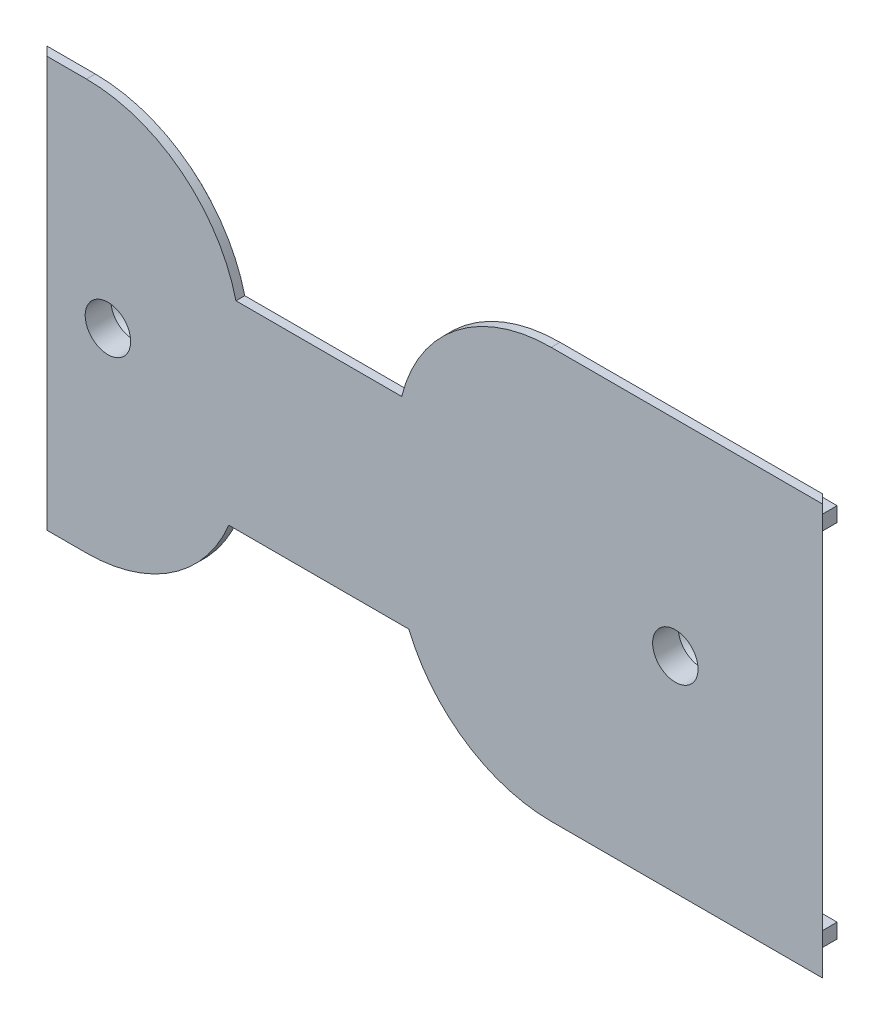
from build123d import *

# Parameters (mm, degrees)
SKETCH_2_R            = 2.6
EXTRUDE_1_DEPTH       = 1.2
EXTRUDE_1_2_DEPTH     = 2
CUT_EXTRUDE_START     = -2
CUT_EXTRUDE_1_DEPTH   = 2
SKETCH_5_W            = 2
SKETCH_5_H            = 47.2
CUT_EXTRUDE_1_2_DEPTH = 2
SKETCH_6_W            = 14.43
SKETCH_6_H            = 14
SKETCH_6_R            = 2.6
EXTRUDE_2_DEPTH       = 5.4
SKETCH_7_R            = 3
SKETCH_7_R_2          = 2
EXTRUDE_2_2_DEPTH     = 2
SKETCH_8_R            = 3.1
CUT_EXTRUDE_2_DEPTH   = 4.6
CHAMFER_1_SIZE        = 1.1
SKETCH_9_R            = 4.6
SKETCH_9_R_2          = 2
EXTRUDE_3_DEPTH       = 2
SKETCH_10_R           = 2.6
SKETCH_10_R_2         = 2
CUT_EXTRUDE_2_2_DEPTH = 2
CUT_EXTRUDE_3_DEPTH   = 62
SKETCH_12_W           = 1.2
SKETCH_12_H           = 2
CUT_EXTRUDE_4_DEPTH   = 62
CUT_EXTRUDE_5_DEPTH   = 62
CUT_EXTRUDE_6_DEPTH   = 2
FILLET_1_R            = 1


# Some blends are built 0.0001 mm under size
with BuildPart() as part:
    # Эскиз2 → Extrude 1 (new body)
    with BuildSketch(Plane.XY):
        with BuildLine():
            Line((31.7, -28), (69.1, -28))
            Line((69.1, -28), (69.1, 28))
            Line((69.1, 28), (31.7, 28))
            ThreePointArc((31.7, 28), (18.738518603, 23.522711642), (11.303921946, 12))
            Line((11.303921946, 12), (10.3, 12))
            Line((10.3, 12), (-11.303921946, 12))
            ThreePointArc((-11.303921946, 12), (-18.738518603, 23.522711642), (-31.7, 28))
            Line((-31.7, 28), (-38.7, 28))
            Line((-38.7, 28), (-38.7, 0))
            Line((-38.7, 0), (-38.7, -28))
            Line((-38.7, -28), (-31.7, -28))
            ThreePointArc((-31.7, -28), (-20.016678554, -24.449928367), (-12.283512161, -15))
            Line((-12.283512161, -15), (10.3, -15))
            Line((10.3, -15), (12.283512161, -15))
            ThreePointArc((12.283512161, -15), (20.016678554, -24.449928367), (31.7, -28))
        make_face()
        with Locations((-28.77, 0)):
            Circle(SKETCH_2_R, mode=Mode.SUBTRACT)
        with Locations((48.63, 0)):
            Circle(SKETCH_2_R, mode=Mode.SUBTRACT)
    extrude(amount=-EXTRUDE_1_DEPTH)

    # Эскиз3 → Extrude 1 2 (add)
    with BuildSketch(Plane(origin=(0, 0, -1.2), x_dir=(-1, 0, 0), z_dir=(0, 0, -1))):
        with BuildLine():
            Line((-12.764102729, 7.6), (13.3, 7.6))
            Line((13.3, 7.6), (13.3, 10.862098312))
            ThreePointArc((13.3, 10.862098312), (20.39638196, 21.767719655), (32.7, 26))
            Line((32.7, 26), (38.7, 26))
            Line((38.7, 26), (38.7, -26))
            Line((38.7, -26), (32.7, -26))
            ThreePointArc((32.7, -26), (21.149339249, -22.32734627), (13.840836227, -12.658223621))
            Line((13.840836227, -12.658223621), (13.840836227, -10.59197668))
            Line((13.840836227, -10.59197668), (13.3, -10.59197668))
            Line((13.3, -10.59197668), (13.3, -10.6))
            Line((13.3, -10.6), (-13.236187424, -10.6))
            ThreePointArc((-13.236187424, -10.6), (-20.290326354, -21.684387141), (-32.7, -26))
            Line((-32.7, -26), (-69.1, -26))
            Line((-69.1, -26), (-69.1, 26))
            Line((-69.1, 26), (-32.7, 26))
            ThreePointArc((-32.7, 26), (-19.135340034, 20.696938457), (-12.764102729, 7.6))
        make_face()
        with BuildLine():
            Line((-15.118191219, 5.2), (15.7, 5.2))
            Line((15.7, 5.2), (15.7, 10.5563143))
            ThreePointArc((15.7, 10.5563143), (21.986250229, 19.963365133), (32.7, 23.6))
            Line((32.7, 23.6), (36.3, 23.6))
            Line((36.3, 23.6), (36.3, -23.6))
            Line((36.3, -23.6), (32.7, -23.6))
            ThreePointArc((32.7, -23.6), (22.698719105, -20.482209102), (16.240836227, -12.233452326))
            Line((16.240836227, -12.233452326), (16.240836227, -8.19197668))
            Line((16.240836227, -8.19197668), (10.9, -8.19197668))
            Line((10.9, -8.19197668), (10.9, -8.2))
            Line((10.9, -8.2), (-15.238041347, -8.2))
            ThreePointArc((-15.238041347, -8.2), (-21.058694231, -19.2), (-32.7, -23.6))
            Line((-32.7, -23.6), (-66.7, -23.6))
            Line((-66.7, -23.6), (-66.7, 23.6))
            Line((-66.7, 23.6), (-32.7, 23.6))
            ThreePointArc((-32.7, 23.6), (-19.975221024, 18.158947323), (-15.118191219, 5.2))
        make_face(mode=Mode.SUBTRACT)
    extrude(amount=EXTRUDE_1_2_DEPTH)

    # Эскиз4 → Cut-Extrude 1 (cut)
    with BuildSketch(Plane(origin=(0, 0, -3.2), x_dir=(-1, 0, 0), z_dir=(0, 0, -1)).offset(CUT_EXTRUDE_START)):
        with BuildLine():
            Line((-13.236187424, -10.6), (13.3, -10.6))
            Line((13.3, -10.6), (13.3, -10.59197668))
            Line((13.3, -10.59197668), (13.840836227, -10.59197668))
            Line((13.840836227, -10.59197668), (13.840836227, -12.658223621))
            ThreePointArc((13.840836227, -12.658223621), (21.149339249, -22.32734627), (32.7, -26))
            Line((32.7, -26), (38.7, -26))
            Line((38.7, -26), (38.7, 26))
            Line((38.7, 26), (32.7, 26))
            ThreePointArc((32.7, 26), (20.39638196, 21.767719655), (13.3, 10.862098312))
            Line((13.3, 10.862098312), (13.3, 7.6))
            Line((13.3, 7.6), (-12.764102729, 7.6))
            ThreePointArc((-12.764102729, 7.6), (-19.135340034, 20.696938457), (-32.7, 26))
            Line((-32.7, 26), (-69.1, 26))
            Line((-69.1, 26), (-69.1, -26))
            Line((-69.1, -26), (-32.7, -26))
            ThreePointArc((-32.7, -26), (-20.290326354, -21.684387141), (-13.236187424, -10.6))
        make_face()
        with BuildLine():
            Line((-13.555287936, -10.2), (12.9, -10.2))
            Line((12.9, -10.2), (12.9, -10.19197668))
            Line((12.9, -10.19197668), (14.240836227, -10.19197668))
            Line((14.240836227, -10.19197668), (14.240836227, -12.589330224))
            ThreePointArc((14.240836227, -12.589330224), (21.408208123, -22.020469288), (32.7, -25.6))
            Line((32.7, -25.6), (38.3, -25.6))
            Line((38.3, -25.6), (38.3, 25.6))
            Line((38.3, 25.6), (32.7, 25.6))
            ThreePointArc((32.7, 25.6), (20.661824927, 21.467460713), (13.7, 10.812483766))
            Line((13.7, 10.812483766), (13.7, 7.2))
            Line((13.7, 7.2), (-13.136769183, 7.2))
            ThreePointArc((-13.136769183, 7.2), (-19.271671735, 20.277254638), (-32.7, 25.6))
            Line((-32.7, 25.6), (-68.7, 25.6))
            Line((-68.7, 25.6), (-68.7, -25.6))
            Line((-68.7, -25.6), (-32.7, -25.6))
            ThreePointArc((-32.7, -25.6), (-20.415049858, -21.27219696), (-13.555287936, -10.2))
        make_face(mode=Mode.SUBTRACT)
    extrude(amount=CUT_EXTRUDE_1_DEPTH, mode=Mode.SUBTRACT)

    # Эскиз5 → Cut-Extrude 1 2 (cut)
    with BuildSketch(Plane(origin=(0, 0, -3.2), x_dir=(-1, 0, 0), z_dir=(0, 0, -1))):
        with Locations((-67.7, 0)):
            Rectangle(SKETCH_5_W, SKETCH_5_H)
        with Locations((37.3, 0)):
            Rectangle(SKETCH_5_W, SKETCH_5_H)
    extrude(amount=-CUT_EXTRUDE_1_2_DEPTH, mode=Mode.SUBTRACT)

    # Эскиз6 → Extrude 2 (add)
    # profile 1 of 2: a face of its own
    with BuildSketch(Plane(origin=(0, 0, -1.2), x_dir=(-1, 0, 0), z_dir=(0, 0, -1))):
        with Locations((-48.415, 0)):
            Rectangle(SKETCH_6_W, SKETCH_6_H)
        with Locations(Location((-48.63, 0, 0), (0, 0, 180))):
            Circle(SKETCH_6_R, mode=Mode.SUBTRACT)
    # profile 2 of 2: a face of its own
    with BuildSketch(Plane(origin=(0, 0, -1.2), x_dir=(-1, 0, 0), z_dir=(0, 0, -1))):
        with Locations((28.985, 0)):
            Rectangle(SKETCH_6_W, SKETCH_6_H)
        with Locations(Location((28.77, 0, 0), (0, 0, 180))):
            Circle(SKETCH_6_R, mode=Mode.SUBTRACT)
    extrude(amount=EXTRUDE_2_DEPTH)

    # Эскиз7 → Extrude 2 2 (add)
    # profile 1 of 2: a face of its own
    with BuildSketch(Plane(origin=(0, 0, -6.6), x_dir=(-1, 0, 0), z_dir=(0, 0, -1))):
        with Locations((-48.63, 0)):
            Circle(SKETCH_7_R)
        with Locations((-48.63, 0)):
            Circle(SKETCH_7_R_2, mode=Mode.SUBTRACT)
    # profile 2 of 2: a face of its own
    with BuildSketch(Plane(origin=(0, 0, -6.6), x_dir=(-1, 0, 0), z_dir=(0, 0, -1))):
        with Locations((28.77, 0)):
            Circle(SKETCH_7_R)
        with Locations((28.77, 0)):
            Circle(SKETCH_7_R_2, mode=Mode.SUBTRACT)
    extrude(amount=-EXTRUDE_2_2_DEPTH)

    # Эскиз8 → Cut-Extrude 2 (cut)
    with BuildSketch(Plane.XY):
        with Locations((-28.77, 0)):
            Circle(SKETCH_8_R)
        with Locations((48.63, 0)):
            Circle(SKETCH_8_R)
    extrude(amount=-CUT_EXTRUDE_2_DEPTH, mode=Mode.SUBTRACT)

    # Фаска1
    chamfer_1_edges = [part.edges().sort_by_distance(p)[0] for p in [
        (-31.87, 0, -4.6),
        (45.53, 0, -4.6),
    ]]
    chamfer(chamfer_1_edges, length=CHAMFER_1_SIZE - 0.0001)  # a hair under: the kernel refuses the full size

    # Эскиз9 → Вытянуть-Тонкостенный3 (add)
    # profile 1 of 3: a face of its own
    with BuildSketch(Plane(origin=(0, 0, -1.2), x_dir=(-1, 0, 0), z_dir=(0, 0, -1))):
        with Locations((39.2, -18)):
            Circle(SKETCH_9_R)
        with Locations((39.2, -18)):
            Circle(SKETCH_9_R_2, mode=Mode.SUBTRACT)
    # profile 2 of 3: a face of its own
    with BuildSketch(Plane(origin=(0, 0, -1.2), x_dir=(-1, 0, 0), z_dir=(0, 0, -1))):
        with Locations((31.2, -18)):
            Circle(SKETCH_9_R)
        with Locations((31.2, -18)):
            Circle(SKETCH_9_R_2, mode=Mode.SUBTRACT)
    # profile 3 of 3: a face of its own
    with BuildSketch(Plane(origin=(0, 0, -1.2), x_dir=(-1, 0, 0), z_dir=(0, 0, -1))):
        with Locations((31.2, -10)):
            Circle(SKETCH_9_R)
        with Locations((31.2, -10)):
            Circle(SKETCH_9_R_2, mode=Mode.SUBTRACT)
    extrude(amount=EXTRUDE_3_DEPTH)

    # Эскиз10 → Cut-Extrude 2 2 (cut)
    # profile 1 of 3: a face of its own
    with BuildSketch(Plane(origin=(0, 0, -3.2), x_dir=(-1, 0, 0), z_dir=(0, 0, -1)).offset(CUT_EXTRUDE_START)):
        with Locations((39.2, -18)):
            Circle(SKETCH_10_R)
        with Locations((39.2, -18)):
            Circle(SKETCH_10_R_2, mode=Mode.SUBTRACT)
    # profile 2 of 3: a face of its own
    with BuildSketch(Plane(origin=(0, 0, -3.2), x_dir=(-1, 0, 0), z_dir=(0, 0, -1)).offset(CUT_EXTRUDE_START)):
        with Locations((31.2, -18)):
            Circle(SKETCH_10_R)
        with Locations((31.2, -18)):
            Circle(SKETCH_10_R_2, mode=Mode.SUBTRACT)
    # profile 3 of 3: a face of its own
    with BuildSketch(Plane(origin=(0, 0, -3.2), x_dir=(-1, 0, 0), z_dir=(0, 0, -1)).offset(CUT_EXTRUDE_START)):
        with Locations((31.2, -10)):
            Circle(SKETCH_10_R)
        with Locations((31.2, -10)):
            Circle(SKETCH_10_R_2, mode=Mode.SUBTRACT)
    extrude(amount=CUT_EXTRUDE_2_2_DEPTH, mode=Mode.SUBTRACT)

    # Эскиз11 → Вырез-Вытянуть3 (cut)
    with BuildSketch(Plane(origin=(0, 28, 0), x_dir=(1, 0, 0), z_dir=(0, 1, 0))):
        Polygon((67.5, 1.2), (69.1, 1.2), (69.1, 0), (68.7, 0), align=None)
    extrude(amount=-CUT_EXTRUDE_3_DEPTH, mode=Mode.SUBTRACT)

    # Эскиз12 → Вырез-Вытянуть4 (cut)
    with BuildSketch(Plane(origin=(0, 25.6, 0), x_dir=(1, 0, 0), z_dir=(0, 1, 0))):
        with Locations((68.1, 2.2)):
            Rectangle(SKETCH_12_W, SKETCH_12_H)
    extrude(amount=-CUT_EXTRUDE_4_DEPTH, mode=Mode.SUBTRACT)

    # Эскиз13 → Вырез-Вытянуть5 (cut)
    with BuildSketch(Plane(origin=(0, 28, 0), x_dir=(1, 0, 0), z_dir=(0, 1, 0))):
        Polygon((-38.7, 1.2), (-38.3, 1.2), (-37.1, 0), (-38.7, 0), align=None)
    extrude(amount=-CUT_EXTRUDE_5_DEPTH, mode=Mode.SUBTRACT)

    # Эскиз14 → Вырез-Вытянуть6 (cut)
    with BuildSketch(Plane.XY.offset(-1.2)):
        with BuildLine():
            Line((-38.3, -15.560737816), (-38.3, -13.488902573))
            ThreePointArc((-38.3, -13.488902573), (-43.8, -18), (-38.3, -22.511097427))
            Line((-38.3, -22.511097427), (-38.3, -20.439262184))
            Line((-38.3, -20.439262184), (-38.3, -15.560737816))
        make_face()
    extrude(amount=-CUT_EXTRUDE_6_DEPTH, mode=Mode.SUBTRACT)

    # Скругление1
    # the kernel refuses this fillet: 1 mm, written as the material it adds along each edge
    with BuildSketch(Plane(origin=(-31.2, -10, -1.2), x_dir=(-0.3113315217302395, 0.9503013646086874, 0), z_dir=(0.9503013646086874, 0.3113315217302395, 0))) as fillet_1_piece_1_section:
        with BuildLine():
            CenterArc((4.6 + FILLET_1_R, -FILLET_1_R), FILLET_1_R, 90, 90)
            Line((4.6, -FILLET_1_R), (4.6, 0))
            Line((4.6, 0), (4.6 + FILLET_1_R, 0))
        make_face()
    fillet_1_piece_1 = revolve(axis=Axis((-31.2, -10, -1.2), (0, 0, 1)), revolution_arc=163.423462372, mode=Mode.PRIVATE)
    fillet_1_piece_1 = fillet_1_piece_1 - Plane(origin=(-31.2, -18, -1.484354145), x_dir=(-1, 0, 0), z_dir=(0, 0, 1)) * Cylinder(2.6, 23, mode=Mode.PRIVATE)
    add(fillet_1_piece_1)
    with BuildSketch(Plane(origin=(-31.2, -10, -1.2), x_dir=(-0.027275325587211355, -0.99962795909984, 0), z_dir=(-0.99962795909984, 0.027275325587211355, 0))) as fillet_1_piece_2_section:
        with BuildLine():
            CenterArc((4.6 + FILLET_1_R, -FILLET_1_R), FILLET_1_R, 90, 90)
            Line((4.6, -FILLET_1_R), (4.6, 0))
            Line((4.6, 0), (4.6 + FILLET_1_R, 0))
        make_face()
    fillet_1_piece_2 = revolve(axis=Axis((-31.2, -10, -1.2), (0, 0, 1)), revolution_arc=163.423462372, mode=Mode.PRIVATE)
    fillet_1_piece_2 = fillet_1_piece_2 - Plane(origin=(-31.2, -18, -1.484354149), x_dir=(-1, 0, 0), z_dir=(0, 0, 1)) * Cylinder(2.6, 23, mode=Mode.PRIVATE)
    add(fillet_1_piece_2)
    with BuildSketch(Plane(origin=(-39.2, -18, -1.2), x_dir=(0.999633679916253, 0.027064847627327897, 0), z_dir=(-0.027064847627327897, 0.999633679916253, 0))) as fillet_1_piece_3_section:
        with BuildLine():
            CenterArc((4.6 + FILLET_1_R, FILLET_1_R), FILLET_1_R, 180, 90)
            Line((4.6, FILLET_1_R), (4.6, 0))
            Line((4.6, 0), (4.6 + FILLET_1_R, 0))
        make_face()
    fillet_1_piece_3 = revolve(axis=Axis((-39.2, -18, -1.2), (0, 0, -1)), revolution_arc=111.410803348, mode=Mode.PRIVATE)
    fillet_1_piece_3 = split(fillet_1_piece_3, bisect_by=Plane(origin=(-38.3, -21.845706148, -1.420542647), z_dir=(1, 0, 0)), keep=Keep.TOP, mode=Mode.PRIVATE)
    fillet_1_piece_3 = fillet_1_piece_3 - Plane(origin=(-31.2, -18, -1.420542647), x_dir=(-1, 0, 0), z_dir=(0, 0, 1)) * Cylinder(2.6, 23, mode=Mode.PRIVATE)
    add(fillet_1_piece_3)
    with BuildSketch(Plane(origin=(-31.2, -18, -1.2), x_dir=(-0.028198782541568913, 0.9996023352629652, 0), z_dir=(-0.9996023352629652, -0.028198782541568913, 0))) as fillet_1_piece_4_section:
        with BuildLine():
            CenterArc((4.6 + FILLET_1_R, FILLET_1_R), FILLET_1_R, 180, 90)
            Line((4.6, FILLET_1_R), (4.6, 0))
            Line((4.6, 0), (4.6 + FILLET_1_R, 0))
        make_face()
    fillet_1_piece_4 = revolve(axis=Axis((-31.2, -18, -1.2), (0, 0, -1)), revolution_arc=273.231770853, mode=Mode.PRIVATE)
    fillet_1_piece_4 = fillet_1_piece_4 - Plane(origin=(-39.2, -18, -1.481900137), x_dir=(-1, 0, 0), z_dir=(0, 0, 1)) * Cylinder(2.6, 23, mode=Mode.PRIVATE)
    fillet_1_piece_4 = fillet_1_piece_4 - Plane(origin=(-31.2, -10, -1.481900137), x_dir=(-1, 0, 0), z_dir=(0, 0, 1)) * Cylinder(2.6, 23, mode=Mode.PRIVATE)
    add(fillet_1_piece_4)
    with BuildSketch(Plane(origin=(-31.2, -18, -1.2), x_dir=(-0.9996347466688219, -0.02702541863431821, 0), z_dir=(0.02702541863431821, -0.9996347466688219, 0))) as fillet_1_piece_5_section:
        with BuildLine():
            CenterArc((4.6 + FILLET_1_R, FILLET_1_R), FILLET_1_R, 180, 90)
            Line((4.6, FILLET_1_R), (4.6, 0))
            Line((4.6, 0), (4.6 + FILLET_1_R, 0))
        make_face()
    fillet_1_piece_5 = revolve(axis=Axis((-31.2, -18, -1.2), (0, 0, -1)), revolution_arc=93.097261959, mode=Mode.PRIVATE)
    fillet_1_piece_5 = fillet_1_piece_5 - Plane(origin=(-39.2, -18, -1.427452975), x_dir=(-1, 0, 0), z_dir=(0, 0, 1)) * Cylinder(2.6, 23, mode=Mode.PRIVATE)
    fillet_1_piece_5 = fillet_1_piece_5 - Plane(origin=(-31.2, -10, -1.427452975), x_dir=(-1, 0, 0), z_dir=(0, 0, 1)) * Cylinder(2.6, 23, mode=Mode.PRIVATE)
    add(fillet_1_piece_5)
    with BuildSketch(Plane(origin=(-39.2, -18, -1.2), x_dir=(-0.33972158483367015, 0.9405260468472415, 0), z_dir=(-0.9405260468472415, -0.33972158483367015, 0))) as fillet_1_piece_6_section:
        with BuildLine():
            CenterArc((4.6 + FILLET_1_R, FILLET_1_R), FILLET_1_R, 180, 90)
            Line((4.6, FILLET_1_R), (4.6, 0))
            Line((4.6, 0), (4.6 + FILLET_1_R, 0))
        make_face()
    fillet_1_piece_6 = revolve(axis=Axis((-39.2, -18, -1.2), (0, 0, -1)), revolution_arc=111.410803348, mode=Mode.PRIVATE)
    fillet_1_piece_6 = split(fillet_1_piece_6, bisect_by=Plane(origin=(-38.3, -14.15429411, -1.420542541), z_dir=(1, 0, 0)), keep=Keep.TOP, mode=Mode.PRIVATE)
    fillet_1_piece_6 = fillet_1_piece_6 - Plane(origin=(-31.2, -18, -1.420542541), x_dir=(-1, 0, 0), z_dir=(0, 0, 1)) * Cylinder(2.6, 23, mode=Mode.PRIVATE)
    add(fillet_1_piece_6)


solid = part.part
